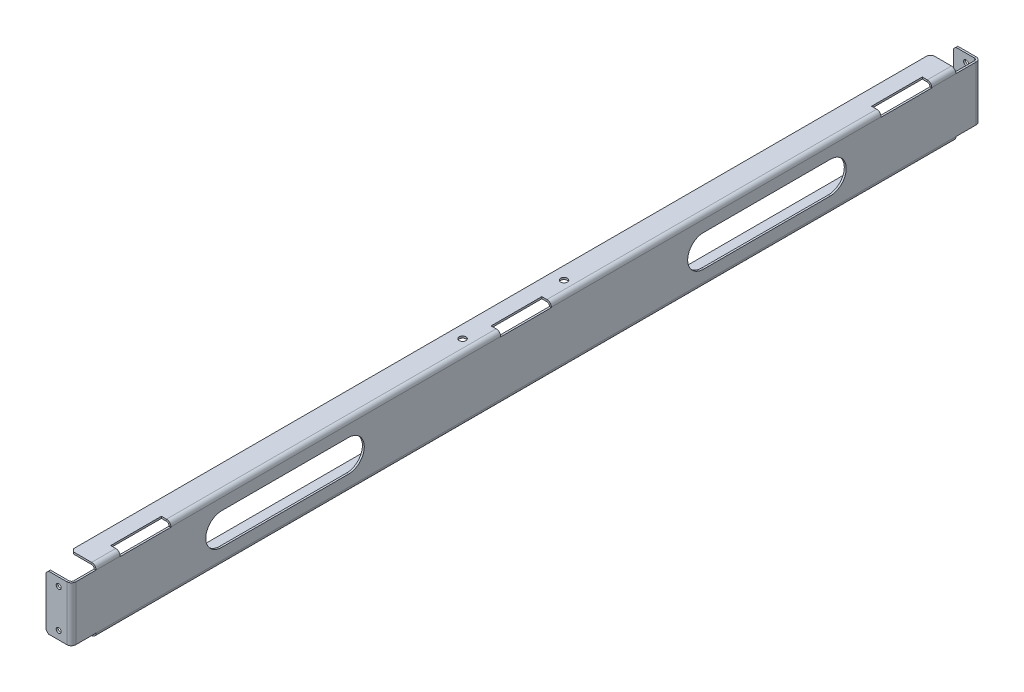
from build123d import *

# Parameters (mm, degrees)
SKETCH1_W                      = 861.06
SKETCH1_H                      = 63.5
BASE_FLANGE1_DEPTH             = 1.89738
EDGE_FLANGE1_STRIP_W           = 12.66952
EDGE_FLANGE1_STRIP_H           = 1.89738
EDGE_FLANGE1_STRIP_CUT_DEPTH   = 861.06
EDGE_FLANGE1_STRIP_2_W         = 12.66952
EDGE_FLANGE1_STRIP_2_H         = 1.89738
EDGE_FLANGE1_STRIP_CUT_2_DEPTH = 861.06
EDGE_FLANGE1_DEPTH             = 861.06
EDGE_FLANGE1_BEND_DEPTH        = 861.06
SKETCH12_W                     = 1.89738
SKETCH12_H                     = 54.62524
BOSS_EXTRUDE1_DEPTH            = 24.765
EDGE_FLANGE2_STRIP_W           = 12.66952
EDGE_FLANGE2_STRIP_H           = 1.89738
EDGE_FLANGE2_STRIP_CUT_DEPTH   = 54.62524
EDGE_FLANGE2_STRIP_2_W         = 12.66952
EDGE_FLANGE2_STRIP_2_H         = 1.89738
EDGE_FLANGE2_STRIP_CUT_2_DEPTH = 54.62524
EDGE_FLANGE2_DEPTH             = 54.62524
EDGE_FLANGE2_BEND_DEPTH        = 54.62524
SKETCH16_W                     = 9.525
SKETCH16_H                     = 50.8
CUT_EXTRUDE1_DEPTH             = 4.7752
LPATTERN1_COUNT                = 3
LPATTERN1_PITCH                = 381
SKETCH17_R                     = 3.3655
CUT_EXTRUDE2_DEPTH             = 2.54
CUT_EXTRUDE3_DEPTH             = 2.54
LPATTERN2_COUNT                = 2
LPATTERN2_PITCH                = 482.6
SKETCH25_R                     = 2.4638
CUT_EXTRUDE4_DEPTH             = 914.154728455
CHAMFER1_SIZE                  = 2.54


# Sheet-metal steps are written as plain solids
with BuildPart() as part:
    # Sketch1 → Base-Flange1 (new body)
    with BuildSketch(Plane(origin=(0, 0, 0), x_dir=(0, 0, -1), z_dir=(1, 0, 0))):
        with Locations((430.53, 31.75)):
            Rectangle(SKETCH1_W, SKETCH1_H)
    extrude(amount=-BASE_FLANGE1_DEPTH)

    # Edge-Flange1 strip (across the edge) → Edge-Flange1 strip cut (cut)
    with BuildSketch(Plane(origin=(-1.89738, 63.5, 0), x_dir=(0, -1, 0), z_dir=(0, 0, -1))):
        with Locations((-1.89738, -0.94869)):
            Rectangle(EDGE_FLANGE1_STRIP_W, EDGE_FLANGE1_STRIP_H)
    extrude(amount=EDGE_FLANGE1_STRIP_CUT_DEPTH, mode=Mode.SUBTRACT)

    # Edge-Flange1 strip 2 (across the edge) → Edge-Flange1 strip cut 2 (cut)
    with BuildSketch(Plane(origin=(-1.89738, 0, -861.06), x_dir=(0, 1, 0), z_dir=(0, 0, 1))):
        with Locations((-1.89738, -0.94869)):
            Rectangle(EDGE_FLANGE1_STRIP_2_W, EDGE_FLANGE1_STRIP_2_H)
    extrude(amount=EDGE_FLANGE1_STRIP_CUT_2_DEPTH, mode=Mode.SUBTRACT)

    # Edge-Flange1 section (across the edge) → Edge-Flange1 (add)
    with BuildSketch(Plane(origin=(-1.89738, 63.5, 0), x_dir=(0, -1, 0), z_dir=(0, 0, -1))):
        with BuildLine():
            Line((0, 2.54), (0, 23.50262))
            Line((0, 23.50262), (1.89738, 23.50262))
            Line((1.89738, 23.50262), (1.89738, 2.54))
            ThreePointArc((1.89738, 2.54), (2.641328776, 0.743948776), (4.43738, 0))
            Line((4.43738, 0), (4.43738, -1.89738))
            ThreePointArc((4.43738, -1.89738), (1.299678511, -0.597701489), (0, 2.54))
        make_face()
    extrude(amount=EDGE_FLANGE1_DEPTH)

    # Edge-Flange1 section 2 (across the edge) → Edge-Flange1 bend (add)
    with BuildSketch(Plane(origin=(-1.89738, 0, -861.06), x_dir=(0, 1, 0), z_dir=(0, 0, 1))):
        with BuildLine():
            Line((0, 2.54), (0, 23.50262))
            Line((0, 23.50262), (1.89738, 23.50262))
            Line((1.89738, 23.50262), (1.89738, 2.54))
            ThreePointArc((1.89738, 2.54), (2.641328776, 0.743948776), (4.43738, 0))
            Line((4.43738, 0), (4.43738, -1.89738))
            ThreePointArc((4.43738, -1.89738), (1.299678511, -0.597701489), (0, 2.54))
        make_face()
    extrude(amount=EDGE_FLANGE1_BEND_DEPTH)

    # Sketch12 → Boss-Extrude1 (add)
    with BuildSketch(Plane.XY):
        with Locations((-0.94869, 31.75)):
            Rectangle(SKETCH12_W, SKETCH12_H)
    boss_extrude1 = extrude(amount=BOSS_EXTRUDE1_DEPTH)

    # Mirror1: Boss-Extrude1 across plane
    add(boss_extrude1.mirror(Plane.XY.offset(-430.53)))

    # Edge-Flange2 strip (across the edge) → Edge-Flange2 strip cut (cut)
    with BuildSketch(Plane(origin=(-1.89738, 4.43738, 24.765), x_dir=(0, 0, -1), z_dir=(0, 1, 0))):
        with Locations((-1.89738, -0.94869)):
            Rectangle(EDGE_FLANGE2_STRIP_W, EDGE_FLANGE2_STRIP_H)
    extrude(amount=EDGE_FLANGE2_STRIP_CUT_DEPTH, mode=Mode.SUBTRACT)

    # Edge-Flange2 strip 2 (across the edge) → Edge-Flange2 strip cut 2 (cut)
    with BuildSketch(Plane(origin=(-1.89738, 59.06262, -885.825), x_dir=(0, 0, 1), z_dir=(0, -1, 0))):
        with Locations((-1.89738, -0.94869)):
            Rectangle(EDGE_FLANGE2_STRIP_2_W, EDGE_FLANGE2_STRIP_2_H)
    extrude(amount=EDGE_FLANGE2_STRIP_CUT_2_DEPTH, mode=Mode.SUBTRACT)

    # Edge-Flange2 section (across the edge) → Edge-Flange2 (add)
    with BuildSketch(Plane(origin=(-1.89738, 4.43738, 24.765), x_dir=(0, 0, -1), z_dir=(0, 1, 0))):
        with BuildLine():
            Line((0, 2.54), (0, 23.50262))
            Line((0, 23.50262), (1.89738, 23.50262))
            Line((1.89738, 23.50262), (1.89738, 2.54))
            ThreePointArc((1.89738, 2.54), (2.641328776, 0.743948776), (4.43738, 0))
            Line((4.43738, 0), (4.43738, -1.89738))
            ThreePointArc((4.43738, -1.89738), (1.299678511, -0.597701489), (0, 2.54))
        make_face()
    extrude(amount=EDGE_FLANGE2_DEPTH)

    # Edge-Flange2 section 2 (across the edge) → Edge-Flange2 bend (add)
    with BuildSketch(Plane(origin=(-1.89738, 59.06262, -885.825), x_dir=(0, 0, 1), z_dir=(0, -1, 0))):
        with BuildLine():
            Line((0, 2.54), (0, 23.50262))
            Line((0, 23.50262), (1.89738, 23.50262))
            Line((1.89738, 23.50262), (1.89738, 2.54))
            ThreePointArc((1.89738, 2.54), (2.641328776, 0.743948776), (4.43738, 0))
            Line((4.43738, 0), (4.43738, -1.89738))
            ThreePointArc((4.43738, -1.89738), (1.299678511, -0.597701489), (0, 2.54))
        make_face()
    extrude(amount=EDGE_FLANGE2_BEND_DEPTH)

    # Sketch16 → Cut-Extrude1 (cut)
    with BuildSketch(Plane(origin=(0, 63.5, 0), x_dir=(1, 0, 0), z_dir=(0, 1, 0))):
        with Locations((-4.7625, 49.53)):
            Rectangle(SKETCH16_W, SKETCH16_H)
    cut_extrude1 = extrude(amount=-CUT_EXTRUDE1_DEPTH, mode=Mode.SUBTRACT)

    # LPattern1: Cut-Extrude1 ×3
    with Locations(*[(0, 0, -i * LPATTERN1_PITCH) for i in range(1, LPATTERN1_COUNT)]):
        add(cut_extrude1, mode=Mode.SUBTRACT)

    # Sketch17 → Cut-Extrude2 (cut)
    with BuildSketch(Plane(origin=(0, 63.5, 0), x_dir=(1, 0, 0), z_dir=(0, 1, 0))):
        with Locations(Location((-12.7, 481.33, 0), (0, 0, 180))):
            Circle(SKETCH17_R)
        with Locations(Location((-12.7, 379.73, 0), (0, 0, 180))):
            Circle(SKETCH17_R)
    extrude(amount=-CUT_EXTRUDE2_DEPTH, mode=Mode.SUBTRACT)

    # Sketch18 → Cut-Extrude3 (cut)
    with BuildSketch(Plane(origin=(0, 0, 0), x_dir=(0, 0, -1), z_dir=(1, 0, 0))):
        with BuildLine():
            Line((125.73, 47.625), (252.73, 47.625))
            ThreePointArc((252.73, 47.625), (268.605, 31.75), (252.73, 15.875))
            Line((252.73, 15.875), (125.73, 15.875))
            ThreePointArc((125.73, 15.875), (109.855, 31.75), (125.73, 47.625))
        make_face()
    cut_extrude3 = extrude(amount=-CUT_EXTRUDE3_DEPTH, mode=Mode.SUBTRACT)

    # LPattern2: Cut-Extrude3 ×2
    with Locations(*[(0, 0, -i * LPATTERN2_PITCH) for i in range(1, LPATTERN2_COUNT)]):
        add(cut_extrude3, mode=Mode.SUBTRACT)

    # Sketch25 → Cut-Extrude4 (cut, through all)
    with BuildSketch(Plane.XY.offset(24.765)):
        with Locations((-12.7, 50.8)):
            Circle(SKETCH25_R)
        with Locations((-12.7, 12.7)):
            Circle(SKETCH25_R)
    extrude(amount=-CUT_EXTRUDE4_DEPTH, mode=Mode.SUBTRACT)

    # Chamfer1
    chamfer1_edges = [part.edges().sort_by_distance(p)[0] for p in [
        (-25.4, 4.43738, 23.81631),
        (-25.4, 59.06262, 23.81631),
        (-25.4, 59.06262, -884.87631),
        (-25.4, 4.43738, -884.87631),
        (-25.4, 62.55131, 0),
        (-25.4, 62.55131, -861.06),
        (-25.4, 0.94869, -861.06),
        (-25.4, 0.94869, 0),
    ]]
    chamfer(chamfer1_edges, length=CHAMFER1_SIZE)


solid = part.part
